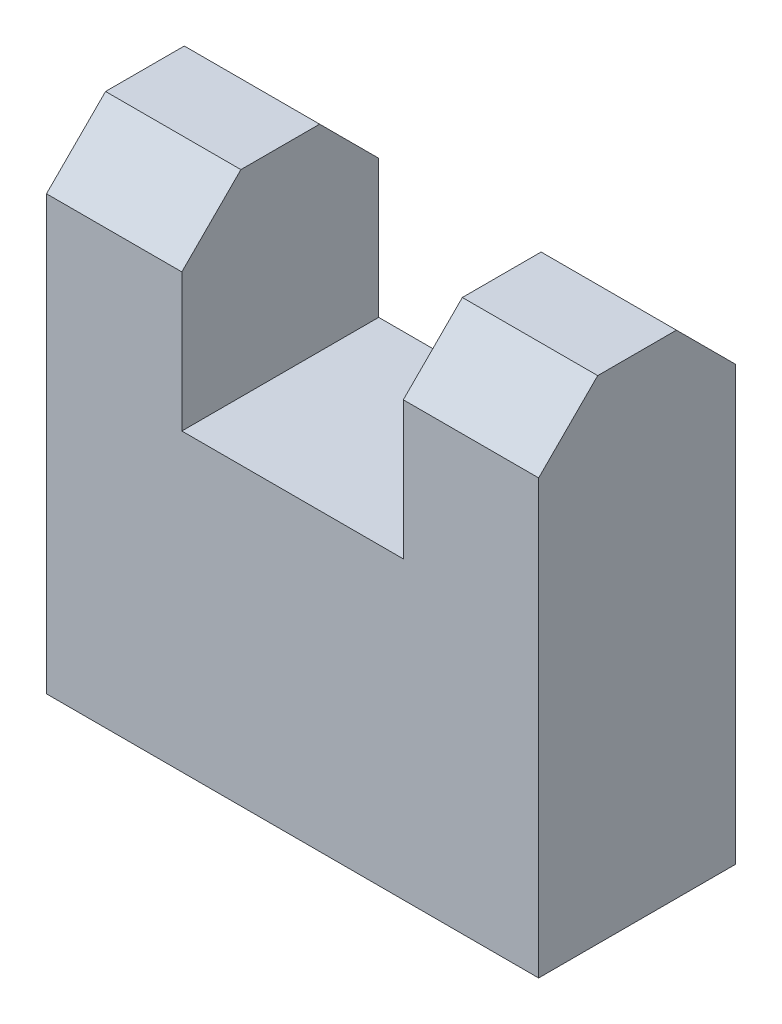
from build123d import *

# Parameters (mm, degrees)
AUFSATZ_LINEAR_AUSTRAGEN1_DEPTH = 40
FASE1_SIZE                      = 12


with BuildPart() as part:
    # Skizze1 → Aufsatz-Linear austragen1 (new body)
    with BuildSketch(Plane.XY):
        Polygon((50, 0), (-50, 0), (-50, 100), (-22.5, 100), (-22.5, 60), (22.5, 60), (22.5, 100), (50, 100), align=None)
    extrude(amount=AUFSATZ_LINEAR_AUSTRAGEN1_DEPTH)

    # Fase1
    fase1_edges = [part.edges().sort_by_distance(p)[0] for p in [
        (-36.25, 100, 0),
        (36.25, 100, 0),
        (36.25, 100, 40),
        (-36.25, 100, 40),
    ]]
    chamfer(fase1_edges, length=FASE1_SIZE)


solid = part.part
